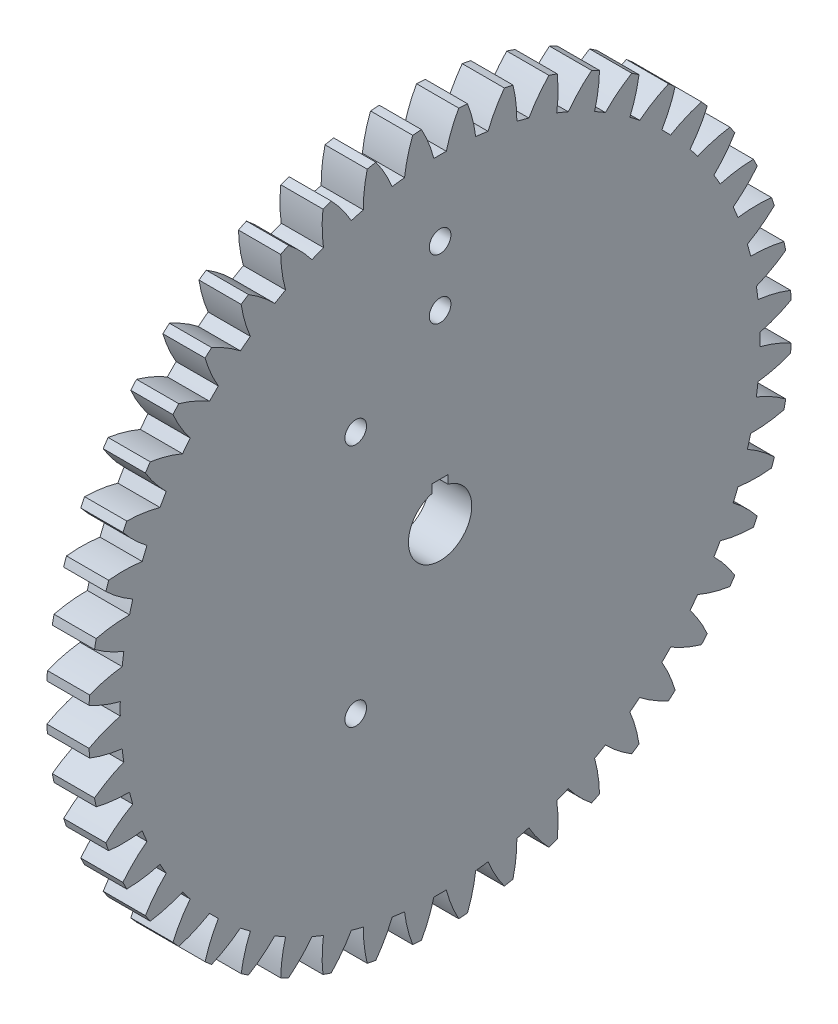
from build123d import *

# Parameters (mm, degrees)
BASPROSKE_W        = 12.7
BASPROSKE_H        = 105.833333333
TOOTHCUT_DEPTH     = 151.208784327
TEETHCUTS_COUNT    = 48
TEETHCUTS_ANGLE    = 352.5
BORSKE_R           = 9.525
BORE_DEPTH         = 50.8001016
KEYSKE_W           = 4.7625
KEYSKE_H           = 11.7348
KEYWAY_DEPTH       = 50.8001016
SKETCH1_R          = 3.2512
CUT_EXTRUDE1_DEPTH = 150.999487388
SKETCH2_R          = 3.2512
CUT_EXTRUDE2_DEPTH = 150.999487388


with BuildPart() as part:
    # BasProSke → Base-Revolve (revolve)
    with BuildSketch(Plane(origin=(0, 0, 0), x_dir=(1, 0, 0), z_dir=(0, 1, 0))):
        with Locations((6.35, 52.916666667)):
            Rectangle(BASPROSKE_W, BASPROSKE_H)
    revolve(axis=Axis((-10, 0, 0), (1, 0, 0)))

    # TooCutSke → ToothCut (cut, through all)
    with BuildSketch(Plane(origin=(0, 0, 0), x_dir=(0, 0, -1), z_dir=(1, 0, 0))):
        with BuildLine():
            ThreePointArc((1.876846967, 96.288773454), (0, 96.307063333), (-1.876846967, 96.288773454))
            ThreePointArc((-1.876846967, 96.288773454), (-3.452860298, 101.11626516), (-5.618618136, 105.70951969))
            ThreePointArc((-5.618618136, 105.70951969), (0, 105.858733333), (5.618618136, 105.70951969))
            ThreePointArc((5.618618136, 105.70951969), (3.452860298, 101.11626516), (1.876846967, 96.288773454))
        make_face()
    toothcut = extrude(amount=TOOTHCUT_DEPTH, mode=Mode.SUBTRACT)

    # TeethCuts: ToothCut ×48 about axis
    teethcuts_axis = Axis((-10, 0, 0), (1, 0, 0))
    for i in range(1, TEETHCUTS_COUNT):
        add(toothcut.rotate(teethcuts_axis, i * TEETHCUTS_ANGLE / (TEETHCUTS_COUNT - 1)), mode=Mode.SUBTRACT)

    # BorSke → Bore (cut, symmetric)
    with BuildSketch(Plane(origin=(0, 0, 0), x_dir=(0, 0, -1), z_dir=(1, 0, 0))):
        Circle(BORSKE_R)
    extrude(amount=BORE_DEPTH, both=True, mode=Mode.SUBTRACT)

    # KeySke → Keyway (cut, symmetric)
    with BuildSketch(Plane(origin=(0, 0, 0), x_dir=(0, 0, -1), z_dir=(1, 0, 0))):
        with Locations((0, 5.8674)):
            Rectangle(KEYSKE_W, KEYSKE_H)
    extrude(amount=KEYWAY_DEPTH, both=True, mode=Mode.SUBTRACT)

    # Sketch1 → Cut-Extrude1 (cut, through all)
    with BuildSketch(Plane.ZY):
        with Locations((0, 73.7743)):
            Circle(SKETCH1_R)
        with Locations((0, 55.7657)):
            Circle(SKETCH1_R)
    extrude(amount=-CUT_EXTRUDE1_DEPTH, mode=Mode.SUBTRACT)

    # Sketch2 → Cut-Extrude2 (cut, through all)
    with BuildSketch(Plane.ZY):
        with Locations((25.4, -36.703)):
            Circle(SKETCH2_R)
        with Locations((25.4, 36.703)):
            Circle(SKETCH2_R)
    extrude(amount=-CUT_EXTRUDE2_DEPTH, mode=Mode.SUBTRACT)


solid = part.part
